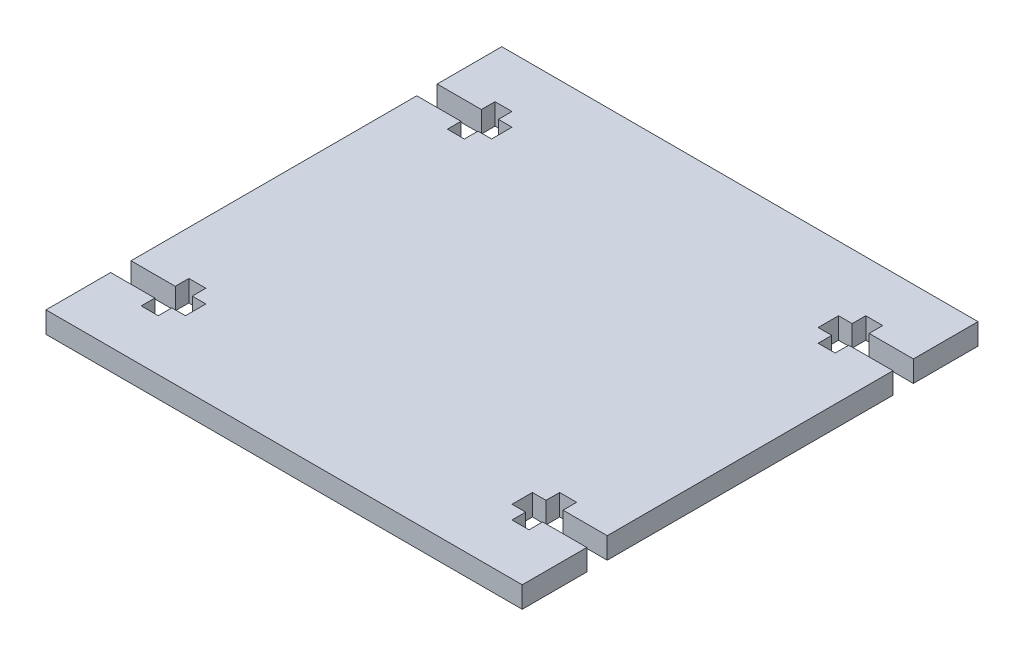
from build123d import *

# Parameters (mm, degrees)
BOSS_EXTRUDE1_DEPTH  = 1.5625
MIRROR4_COPY_1_DEPTH = 1.5625
MIRROR4_COPY_2_DEPTH = 1.5625


with BuildPart() as part:
    # Sketch1 → Boss-Extrude1 (new, symmetric)
    with BuildSketch(Plane(origin=(0, 0, 0), x_dir=(1, 0, 0), z_dir=(0, 1, 0))):
        Polygon((0, 33.5), (35, 33.5), (35, 24), (28.5, 24), (28.5, 26), (26, 26), (26, 24), (24, 24), (24, 21), (26, 21), (26, 19), (28.5, 19), (28.5, 21), (35, 21), (35, 0), (0, 0), align=None)
    boss_extrude1 = extrude(amount=BOSS_EXTRUDE1_DEPTH, both=True)

    # Mirror1: Boss-Extrude1 across plane
    add(boss_extrude1.mirror(Plane(origin=(0, 0, 0), x_dir=(0, 0, 1), z_dir=(1, 0, 0))))

    # Mirror4 copy 1 sketch → Mirror4 copy 1 (add, symmetric)
    with BuildSketch(Plane(origin=(0, 0, 0), x_dir=(-1, 0, 0), z_dir=(0, 1, 0))):
        Polygon((0, 33.5), (35, 33.5), (35, 24), (28.5, 24), (28.5, 26), (26, 26), (26, 24), (24, 24), (24, 21), (26, 21), (26, 19), (28.5, 19), (28.5, 21), (35, 21), (35, 0), (0, 0), align=None)
    extrude(amount=MIRROR4_COPY_1_DEPTH, both=True)

    # Mirror4 copy 2 sketch → Mirror4 copy 2 (add, symmetric)
    with BuildSketch(Plane(origin=(0, 0, 0), x_dir=(1, 0, 0), z_dir=(0, 1, 0))):
        Polygon((0, -33.5), (35, -33.5), (35, -24), (28.5, -24), (28.5, -26), (26, -26), (26, -24), (24, -24), (24, -21), (26, -21), (26, -19), (28.5, -19), (28.5, -21), (35, -21), (35, 0), (0, 0), align=None)
    extrude(amount=MIRROR4_COPY_2_DEPTH, both=True)


solid = part.part
